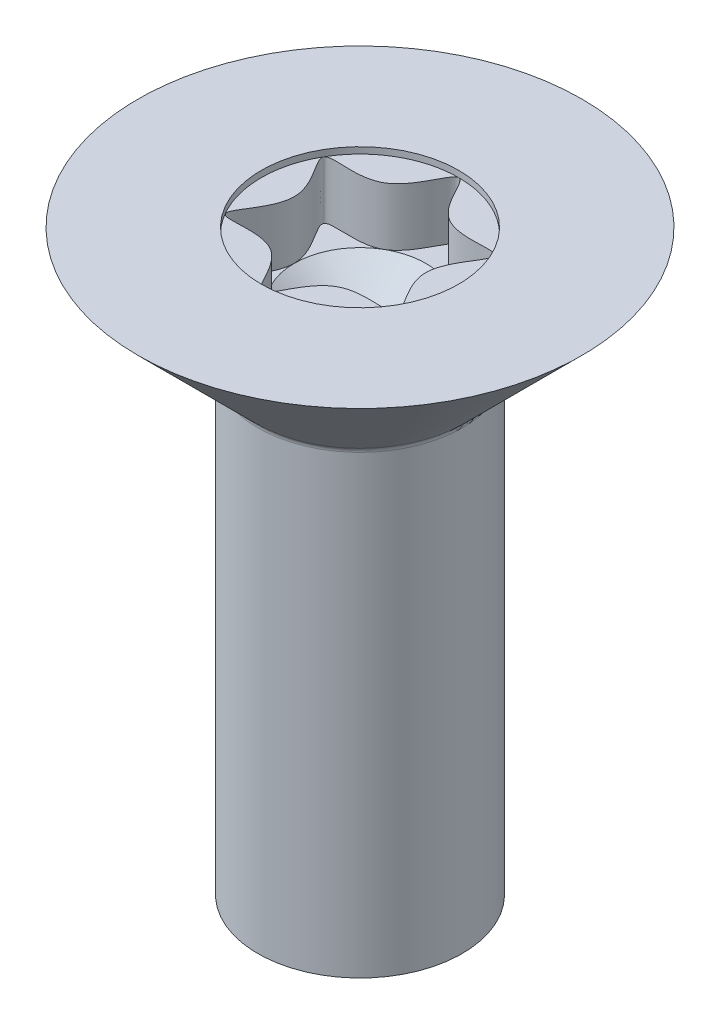
from build123d import *

# Parameters (mm, degrees)
RECESS_CUT_EXTRUDE1_DEPTH = 0.91
SKETCH3_R                 = 1.4
RECESS_CUT_EXTRUDE2_DEPTH = 0.091
FILLET1_R                 = 0.1


with BuildPart() as part:
    # Sketch1 → Body-Revolve (revolve)
    with BuildSketch(Plane.XY):
        Polygon((0, 8.2), (3.15, 8.2), (1.45, 6.5), (1.45, 0), (0, 0), align=None)
    revolve(axis=Axis((0, 0, 0), (0, 1, 0)))

    # Sketch2 → Recess-Cut-Extrude1 (cut)
    with BuildSketch(Plane(origin=(0, 8.2, 0), x_dir=(-1, 0, 0), z_dir=(0, 1, 0))):
        with BuildLine():
            add(Edge.make_bspline(
                [(0, -1.4), (-0.100650939, -1.4), (-0.301952816, -0.522997619), (-1.592188736, -0.919250595), (-0.603905632, 0), (-1.592188736, 0.919250595), (-0.301952816, 0.522997619), (0, 1.838501191), (0.301952816, 0.522997619), (1.592188736, 0.919250595), (0.603905632, 0), (1.592188736, -0.919250595), (0.301952816, -0.522997619), (0.100650939, -1.4), (0, -1.4)],
                knots=[0, 0, 0, 0, 0.083333333, 0.166666667, 0.25, 0.333333333, 0.416666667, 0.5, 0.583333333, 0.666666667, 0.75, 0.833333333, 0.916666667, 1, 1, 1, 1], degree=3))
        make_face()
    extrude(amount=-RECESS_CUT_EXTRUDE1_DEPTH, mode=Mode.SUBTRACT)

    # Sketch3 → Recess-Cut-Extrude2 (cut)
    with BuildSketch(Plane(origin=(0, 8.2, 0), x_dir=(-1, 0, 0), z_dir=(0, 1, 0))):
        Circle(SKETCH3_R)
    extrude(amount=-RECESS_CUT_EXTRUDE2_DEPTH, mode=Mode.SUBTRACT)

    # Sketch4 → Drill-Cut-Revolve (revolve, cut)
    with BuildSketch(Plane.XY):
        Polygon((0, 7.29), (0.933333333, 7.29), (0, 6.67), align=None)
    revolve(axis=Axis((0, 0, 0), (0, 1, 0)), mode=Mode.SUBTRACT)

    # Fillet1
    fillet1_edges = [part.edges().sort_by_distance(p)[0] for p in [
        (-1.45, 6.5, 0),
    ]]
    fillet(fillet1_edges, radius=FILLET1_R)


solid = part.part
